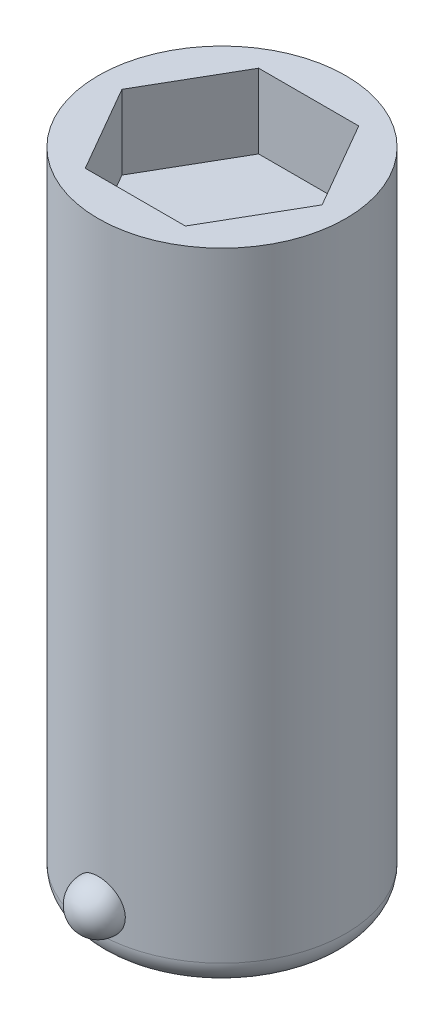
from build123d import *

# Parameters (mm, degrees)
SKETCH1_R           = 5
BOSS_EXTRUDE1_DEPTH = 26
CUT_EXTRUDE1_DEPTH  = 3
FILLET1_R           = 1


with BuildPart() as part:
    # Sketch1 → Boss-Extrude1 (new body)
    with BuildSketch(Plane(origin=(0, 0, 0), x_dir=(1, 0, 0), z_dir=(0, 1, 0))):
        with Locations(Location((0, 0, 0), (0, 0, 90))):
            Circle(SKETCH1_R)
    extrude(amount=BOSS_EXTRUDE1_DEPTH)

    # Sketch2 → Cut-Revolve1 (revolve, cut)
    with BuildSketch(Plane.XY):
        with BuildLine():
            Line((0, -4.1), (0, 4.1))
            ThreePointArc((0, 4.1), (4.1, 0), (0, -4.1))
        make_face()
    revolve(axis=Axis((0, -4.1, 0), (0, 1, 0)), mode=Mode.SUBTRACT)

    # Sketch4 → Revolve1 (revolve)
    with BuildSketch(Plane(origin=(0, 2, 0), x_dir=(1, 0, 0), z_dir=(0, 1, 0))):
        with BuildLine():
            Line((0, 6), (0, 5))
            ThreePointArc((0, 5), (0.5, 4.974937186), (0.994987437, 4.9))
            ThreePointArc((0.994987437, 4.9), (0.741619849, 5.670820393), (0, 6))
        make_face()
    revolve1 = revolve(axis=Axis((0, 2, 0), (0, 0, -1)))

    # Sketch5 → Cut-Extrude1 (cut)
    with BuildSketch(Plane(origin=(0, 26, 0), x_dir=(1, 0, 0), z_dir=(0, 1, 0))):
        Polygon((-4.041451884, 0), (-2.020725942, -3.5), (2.020725942, -3.5), (4.041451884, 0), (2.020725942, 3.5), (-2.020725942, 3.5), align=None)
    extrude(amount=-CUT_EXTRUDE1_DEPTH, mode=Mode.SUBTRACT)

    # Mirror1: Revolve1 across plane
    add(revolve1.mirror(Plane.XY))

    # Fillet1
    # the kernel refuses this fillet: 1 mm, written as the material it takes off along each edge
    with BuildSketch(Plane(origin=(0, 0, 0), x_dir=(0, 0, -1), z_dir=(1, 0, 0))) as fillet1_piece_1:
        with BuildLine():
            CenterArc((4, 0.994987437), FILLET1_R, 275.739170477, 84.260829523)
            Line((4.1, 0), (4.102, -0.019899749))
            ThreePointArc((4.102, -0.019899749), (4.55, -0.02), (5, -0.02))
            Line((5, -0.02), (5.02, 0))
            Line((5.02, 0), (5.02, 0.994987437))
            Line((5.02, 0.994987437), (5, 0.994987437))
        make_face()
    revolve(axis=Axis((0, 0, 0), (0, 1, 0)), mode=Mode.SUBTRACT)


solid = part.part
